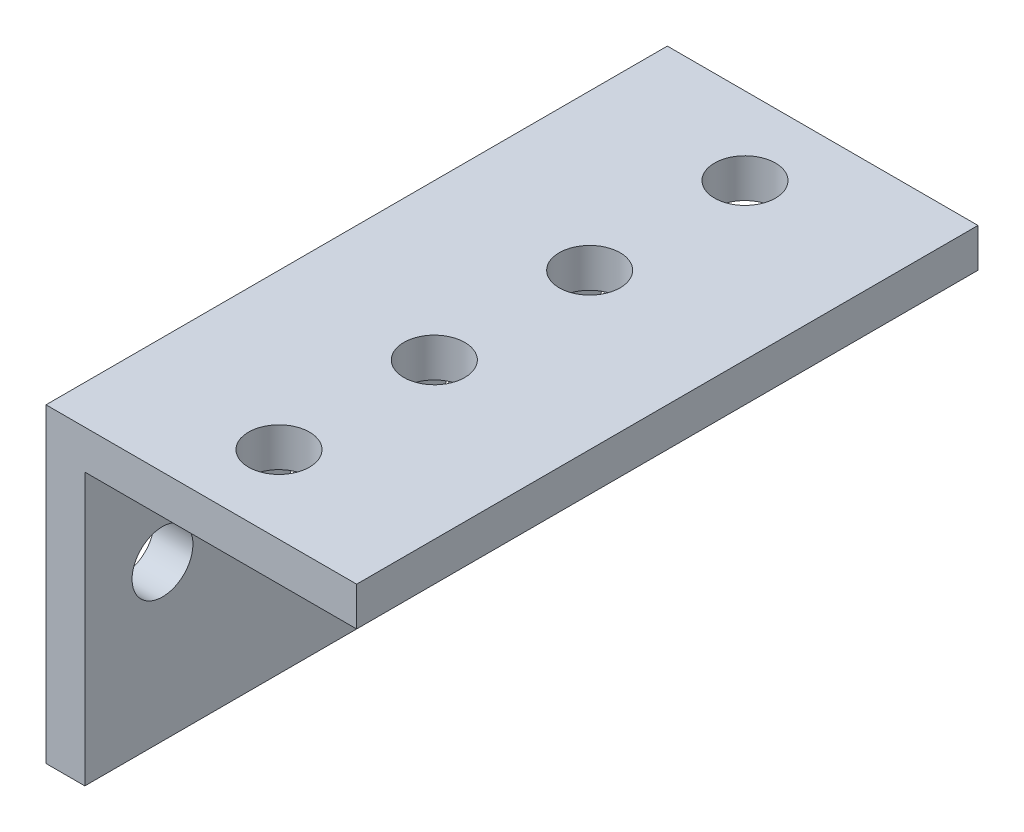
from build123d import *

# Parameters (mm, degrees)
BOSS_EXTRUDE1_DEPTH = 50.8
SKETCH5_R           = 2.4892
CUT_EXTRUDE1_DEPTH  = 61.989758362
SKETCH6_R           = 2.4892
CUT_EXTRUDE2_DEPTH  = 61.989758362


with BuildPart() as part:
    # Sketch2 → Boss-Extrude1 (new body)
    with BuildSketch(Plane.XY):
        Polygon((0, 0), (0, -25.4), (3.175, -25.4), (3.175, -3.175), (25.4, -3.175), (25.4, 0), align=None)
    extrude(amount=BOSS_EXTRUDE1_DEPTH)

    # Sketch5 → Cut-Extrude1 (cut, through all)
    with BuildSketch(Plane(origin=(3.175, 0, 0), x_dir=(0, 0, -1), z_dir=(1, 0, 0))):
        with Locations((-6.35, -12.7)):
            Circle(SKETCH5_R)
        with Locations((-19.05, -12.7)):
            Circle(SKETCH5_R)
        with Locations((-31.75, -12.7)):
            Circle(SKETCH5_R)
        with Locations((-44.45, -12.7)):
            Circle(SKETCH5_R)
    extrude(amount=-CUT_EXTRUDE1_DEPTH, mode=Mode.SUBTRACT)

    # Sketch6 → Cut-Extrude2 (cut, through all)
    with BuildSketch(Plane.XZ.offset(3.175)):
        with Locations((12.7, 6.35)):
            Circle(SKETCH6_R)
        with Locations((12.7, 19.05)):
            Circle(SKETCH6_R)
        with Locations((12.7, 31.75)):
            Circle(SKETCH6_R)
        with Locations((12.7, 44.45)):
            Circle(SKETCH6_R)
    extrude(amount=-CUT_EXTRUDE2_DEPTH, mode=Mode.SUBTRACT)


solid = part.part
